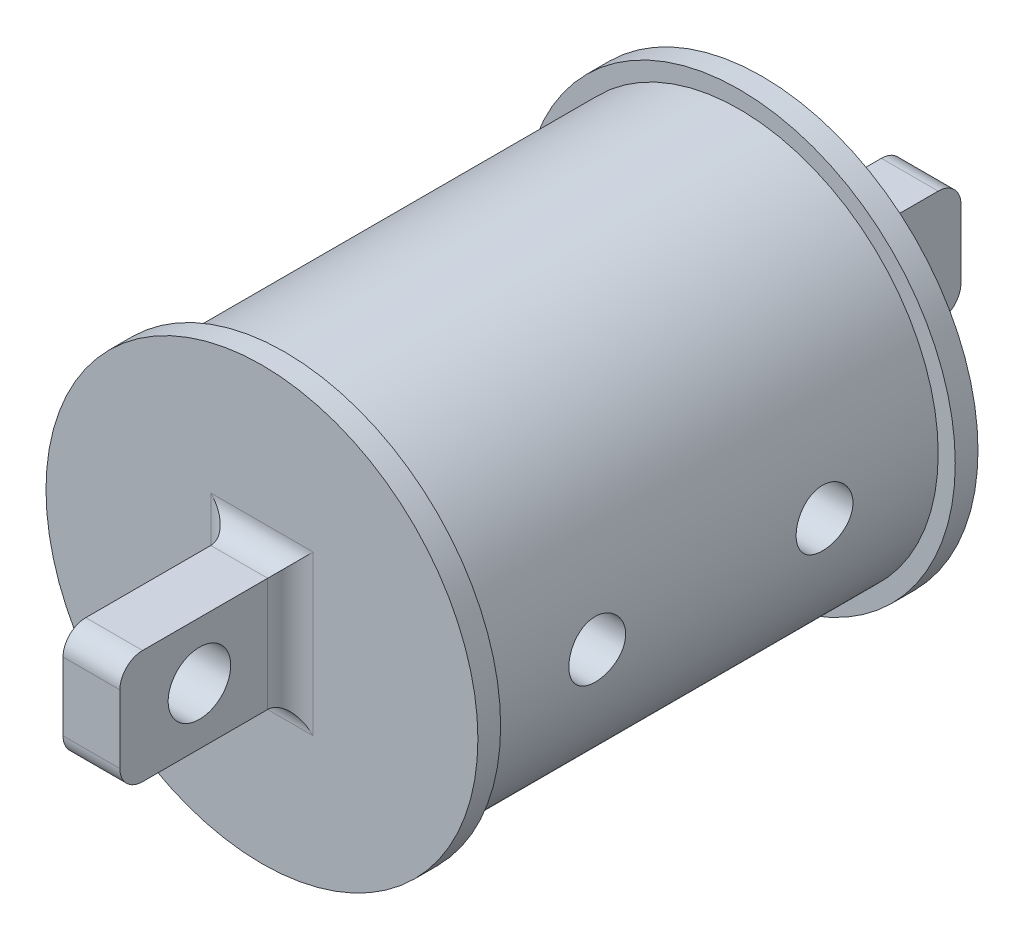
from build123d import *

# Parameters (mm, degrees)
SKETCH1_R               = 22.225
BOSS_EXTRUDE1_DEPTH     = 25.4
SKETCH2_R               = 24.13
BOSS_EXTRUDE2_DEPTH     = 2.54
SKETCH3_W               = 6.35
SKETCH3_H               = 12.7
BOSS_EXTRUDE3_DEPTH     = 19.05
SKETCH4_R               = 3.4925
CUT_EXTRUDE1_DEPTH      = 60.463266182
FILLET1_R               = 2.54
FILLET1_OF_MIRROR1_R    = 2.54
CUT_EXTRUDE2_DEPTH      = 59.073865895
CUT_EXTRUDE2_DEPTH_BACK = 59.073865895
SKETCH5_R               = 3.175


with BuildPart() as part:
    # Sketch1 → Boss-Extrude1 (new, symmetric)
    with BuildSketch(Plane.XY):
        Circle(SKETCH1_R)
    extrude(amount=BOSS_EXTRUDE1_DEPTH, both=True)

    # Sketch2 → Boss-Extrude2 (add)
    with BuildSketch(Plane.XY.offset(25.4)):
        Circle(SKETCH2_R)
    boss_extrude2 = extrude(amount=BOSS_EXTRUDE2_DEPTH)

    # Sketch3 → Boss-Extrude3 (add)
    with BuildSketch(Plane.XY.offset(27.94)):
        Rectangle(SKETCH3_W, SKETCH3_H)
    boss_extrude3 = extrude(amount=BOSS_EXTRUDE3_DEPTH)

    # Sketch4 → Cut-Extrude1 (cut, through all)
    with BuildSketch(Plane(origin=(3.175, 0, 0), x_dir=(0, 0, -1), z_dir=(1, 0, 0))):
        with Locations((-38.1, 0)):
            Circle(SKETCH4_R)
    cut_extrude1 = extrude(amount=-CUT_EXTRUDE1_DEPTH, mode=Mode.SUBTRACT)

    # Fillet1
    fillet1_edges = [part.edges().sort_by_distance(p)[0] for p in [
        (0, -6.35, 27.94),
        (0, 6.35, 27.94),
        (0, -6.35, 46.99),
        (0, 6.35, 46.99),
        (-3.175, 0, 27.94),
        (3.175, 0, 27.94),
    ]]
    fillet(fillet1_edges, radius=FILLET1_R)

    # Mirror1: Boss-Extrude2, Boss-Extrude3, Cut-Extrude1 across plane
    add(boss_extrude2.mirror(Plane.XY))
    add(boss_extrude3.mirror(Plane.XY))
    add(cut_extrude1.mirror(Plane.XY), mode=Mode.SUBTRACT)

    # Fillet1 of Mirror1
    fillet1_of_mirror1_edges = [part.edges().sort_by_distance(p)[0] for p in [
        (0, -6.35, -27.94),
        (0, 6.35, -27.94),
        (0, -6.35, -46.99),
        (0, 6.35, -46.99),
        (-3.175, 0, -27.94),
        (3.175, 0, -27.94),
    ]]
    fillet(fillet1_of_mirror1_edges, radius=FILLET1_OF_MIRROR1_R)

    # Sketch5 → Cut-Extrude2 (cut, two sides: drawn at the far end of the back side and taken through both)
    with BuildSketch(Plane(origin=(0, 0, 0), x_dir=(0, 0, -1), z_dir=(1, 0, 0)).offset(-CUT_EXTRUDE2_DEPTH_BACK)):
        with Locations((-12.7, 0)):
            Circle(SKETCH5_R)
        with Locations((12.7, 0)):
            Circle(SKETCH5_R)
    extrude(amount=CUT_EXTRUDE2_DEPTH + CUT_EXTRUDE2_DEPTH_BACK, mode=Mode.SUBTRACT)


solid = part.part
